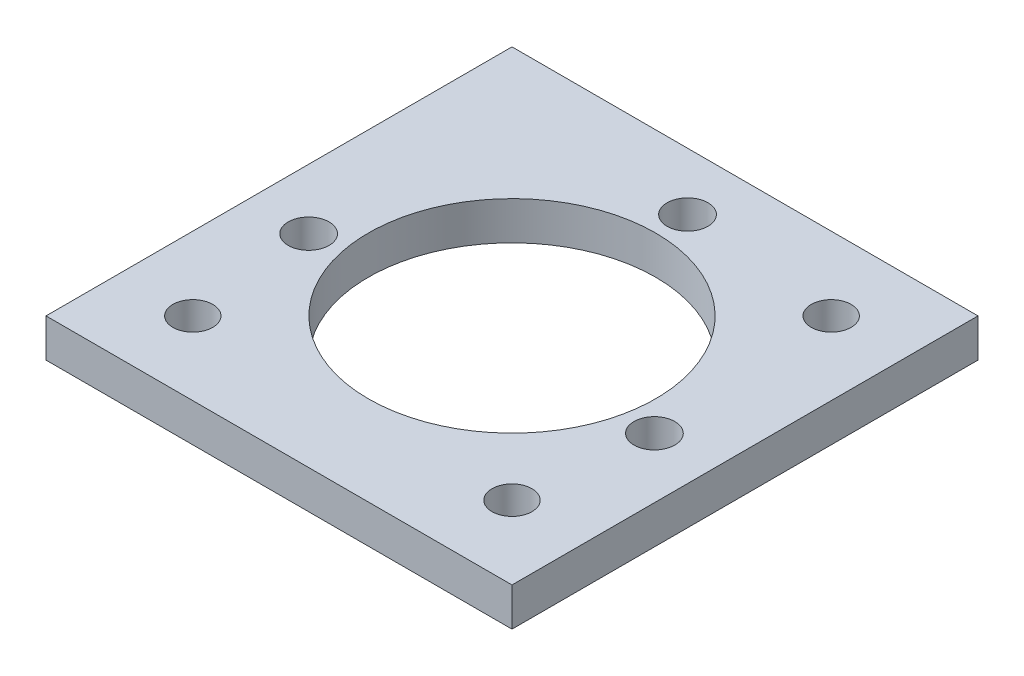
from build123d import *

# Parameters (mm, degrees)
SKETCH1_W                        = 73
SKETCH1_H                        = 73
SKETCH1_R                        = 3.2
SKETCH1_R_2                      = 22.5
BOSS_EXTRUDE1_DEPTH              = 6
TAP_DRILL_FOR_M6_HELICOIL1_D     = 6.25
TAP_DRILL_FOR_M6_HELICOIL1_DEPTH = 11.94
TAP_DRILL_FOR_M6_HELICOIL1_TIP   = 1.877689434


with BuildPart() as part:
    # Sketch1 → Boss-Extrude1 (new body)
    with BuildSketch(Plane(origin=(0, 0, 0), x_dir=(1, 0, 0), z_dir=(0, 1, 0))):
        with Locations((36.5, 36.5)):
            Rectangle(SKETCH1_W, SKETCH1_H)
        with Locations((36.5, 64)):
            Circle(SKETCH1_R, mode=Mode.SUBTRACT)
        with Locations((63.582213208, 31.724675114)):
            Circle(SKETCH1_R, mode=Mode.SUBTRACT)
        with Locations((9.417786792, 31.724675114)):
            Circle(SKETCH1_R, mode=Mode.SUBTRACT)
        with Locations((36.5, 36.5)):
            Circle(SKETCH1_R_2, mode=Mode.SUBTRACT)
    extrude(amount=BOSS_EXTRUDE1_DEPTH)

    # Tap Drill for M6 Helicoil1
    with Locations(Plane(origin=(0, 0, 0), x_dir=(-1, 0, 0), z_dir=(0, -1, 0))):
        with Locations((-11.5, 11.5), (-61.5, 11.5), (-61.5, 61.5)):
            Hole(TAP_DRILL_FOR_M6_HELICOIL1_D / 2, depth=TAP_DRILL_FOR_M6_HELICOIL1_DEPTH)
            with Locations((0, 0, -(TAP_DRILL_FOR_M6_HELICOIL1_DEPTH + TAP_DRILL_FOR_M6_HELICOIL1_TIP / 2))):  # 118° drill point
                Cone(0, TAP_DRILL_FOR_M6_HELICOIL1_D / 2, TAP_DRILL_FOR_M6_HELICOIL1_TIP, mode=Mode.SUBTRACT)


solid = part.part
